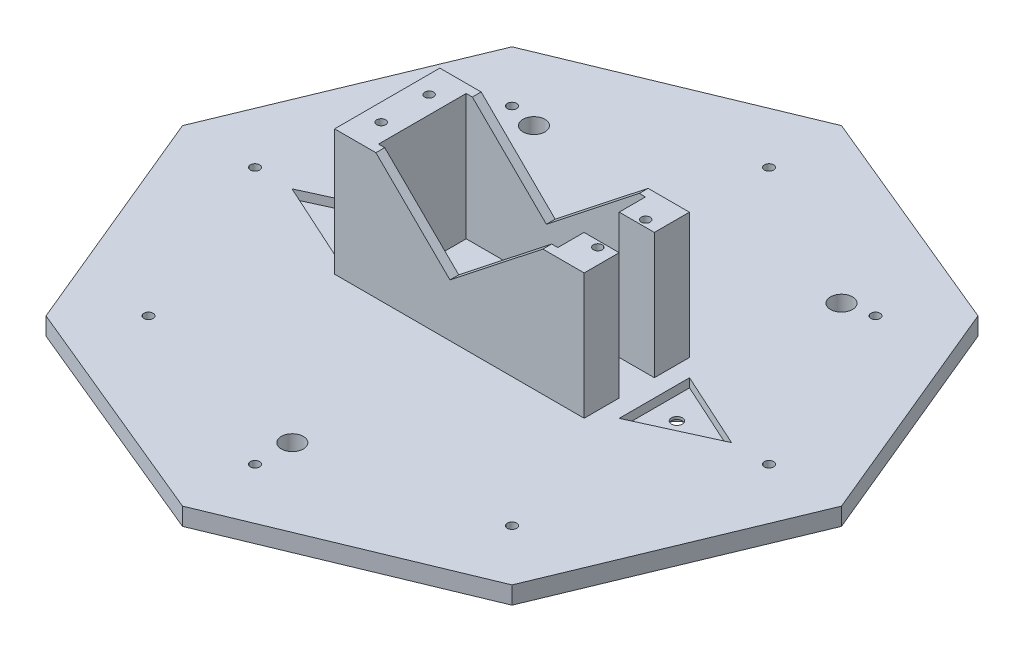
from build123d import *

# Parameters (mm, degrees)
AUFSATZ_LINEAR_AUSTRAGEN1_DEPTH      = 3
AUFSATZ_LINEAR_AUSTRAGEN1_DEPTH_BACK = 1
AUFSATZ_LINEAR_AUSTRAGEN3_DEPTH      = 31.65
SCHNITT_LINEAR_AUSTRAGEN1_DEPTH      = 28.65
SKIZZE7_R                            = 2.5
SCHNITT_LINEAR_AUSTRAGEN2_DEPTH      = 110.867294952
SCHNITT_LINEAR_AUSTRAGEN6_DEPTH      = 2
SKIZZE9_R                            = 1
SCHNITT_LINEAR_AUSTRAGEN5_DEPTH      = 13.1
SKIZZE10_R                           = 1.25
SCHNITT_LINEAR_AUSTRAGEN7_DEPTH      = 111.405717696
SKIZZE11_R                           = 2.75
SCHNITT_LINEAR_AUSTRAGEN8_DEPTH      = 1.4
SKIZZE14_R                           = 1.05
SCHNITT_LINEAR_AUSTRAGEN9_DEPTH      = 10


with BuildPart() as part:
    # Skizze2 → Aufsatz-Linear austragen1 (new, two sides: drawn at the far end of the back side and taken through both)
    with BuildSketch(Plane(origin=(0, 0, 0), x_dir=(1, 0, 0), z_dir=(0, 1, 0)).offset(-AUFSATZ_LINEAR_AUSTRAGEN1_DEPTH_BACK)):
        Polygon((-53.033008589, 53.033008589), (-75, 0), (-53.033008589, -53.033008589), (0, -75), (53.033008589, -53.033008589), (75, 0), (53.033008589, 53.033008589), (0, 75), align=None)
    extrude(amount=AUFSATZ_LINEAR_AUSTRAGEN1_DEPTH + AUFSATZ_LINEAR_AUSTRAGEN1_DEPTH_BACK)

    # Skizze5 → Aufsatz-Linear austragen3 (add)
    with BuildSketch(Plane(origin=(0, 0, 0), x_dir=(1, 0, 0), z_dir=(0, 1, 0))):
        Polygon((20.4, -4), (28.4, -4), (28.4, -11.975), (-28.4, -11.975), (-28.4, 11.975), (28.4, 11.975), (28.4, 4), (20.4, 4), (20.4, 9.975), (-20.4, 9.975), (-20.4, -9.975), (20.4, -9.975), align=None)
    extrude(amount=AUFSATZ_LINEAR_AUSTRAGEN3_DEPTH)

    # Skizze6 → Schnitt-Linear austragen1 (cut)
    with BuildSketch(Plane.XY.offset(11.975)):
        Polygon((-19, 31.65), (19, 31.65), (-2.152730863, 14.994542406), align=None)
    extrude(amount=-SCHNITT_LINEAR_AUSTRAGEN1_DEPTH, mode=Mode.SUBTRACT)

    # Skizze7 → Schnitt-Linear austragen2 (cut, through all)
    with BuildSketch(Plane(origin=(0, 3, 0), x_dir=(1, 0, 0), z_dir=(0, 1, 0))):
        with Locations((35, 40)):
            Circle(SKIZZE7_R)
        with Locations((-35, 40)):
            Circle(SKIZZE7_R)
        with Locations((0, -50)):
            Circle(SKIZZE7_R)
    extrude(amount=-SCHNITT_LINEAR_AUSTRAGEN2_DEPTH, mode=Mode.SUBTRACT)

    # Skizze8 → Schnitt-Linear austragen6 (cut)
    with BuildSketch(Plane(origin=(0, 3, 0), x_dir=(1, 0, 0), z_dir=(0, 1, 0))):
        Polygon((-32.4, -8.05), (-32.4, 8.05), (-50.075644699, 0), align=None)
        Polygon((49.9752149, 0), (32.4, 8.004261364), (32.4, -8.004261364), align=None)
    extrude(amount=-SCHNITT_LINEAR_AUSTRAGEN6_DEPTH, mode=Mode.SUBTRACT)

    # Skizze9 → Schnitt-Linear austragen5 (cut)
    with BuildSketch(Plane(origin=(0, 31.65, 0), x_dir=(1, 0, 0), z_dir=(0, 1, 0))):
        with Locations((-24.4, -5.375)):
            Circle(SKIZZE9_R)
        with Locations((-24.4, 5.525)):
            Circle(SKIZZE9_R)
        with Locations((24.9, 5.525)):
            Circle(SKIZZE9_R)
        with Locations((24.9, -5.375)):
            Circle(SKIZZE9_R)
    extrude(amount=-SCHNITT_LINEAR_AUSTRAGEN5_DEPTH, mode=Mode.SUBTRACT)

    # Skizze10 → Schnitt-Linear austragen7 (cut, through all)
    with BuildSketch(Plane(origin=(0, 1, 0), x_dir=(1, 0, 0), z_dir=(0, 1, 0))):
        with Locations((-37.487800905, 0)):
            Circle(SKIZZE10_R)
        with Locations((37.49, 0.05)):
            Circle(SKIZZE10_R)
    extrude(amount=-SCHNITT_LINEAR_AUSTRAGEN7_DEPTH, mode=Mode.SUBTRACT)

    # Skizze11 → Schnitt-Linear austragen8 (cut)
    with BuildSketch(Plane.XZ.offset(1)):
        with Locations((-37.487800905, 0)):
            Circle(SKIZZE11_R)
        with Locations((37.49, -0.05)):
            Circle(SKIZZE11_R)
    extrude(amount=-SCHNITT_LINEAR_AUSTRAGEN8_DEPTH, mode=Mode.SUBTRACT)

    # Skizze14 → Schnitt-Linear austragen9 (cut)
    with BuildSketch(Plane(origin=(0, 3, 0), x_dir=(1, 0, 0), z_dir=(0, 1, 0))):
        with Locations((-58.5, 0)):
            Circle(SKIZZE14_R)
        with Locations((0, 58.5)):
            Circle(SKIZZE14_R)
        with Locations((-41.365746699, 41.365746699)):
            Circle(SKIZZE14_R)
        with Locations((41.365746699, 41.365746699)):
            Circle(SKIZZE14_R)
        with Locations((58.5, 0)):
            Circle(SKIZZE14_R)
        with Locations((41.365746699, -41.365746699)):
            Circle(SKIZZE14_R)
        with Locations((-41.365746699, -41.365746699)):
            Circle(SKIZZE14_R)
        with Locations((0, -58.5)):
            Circle(SKIZZE14_R)
    extrude(amount=-SCHNITT_LINEAR_AUSTRAGEN9_DEPTH, mode=Mode.SUBTRACT)


solid = part.part
